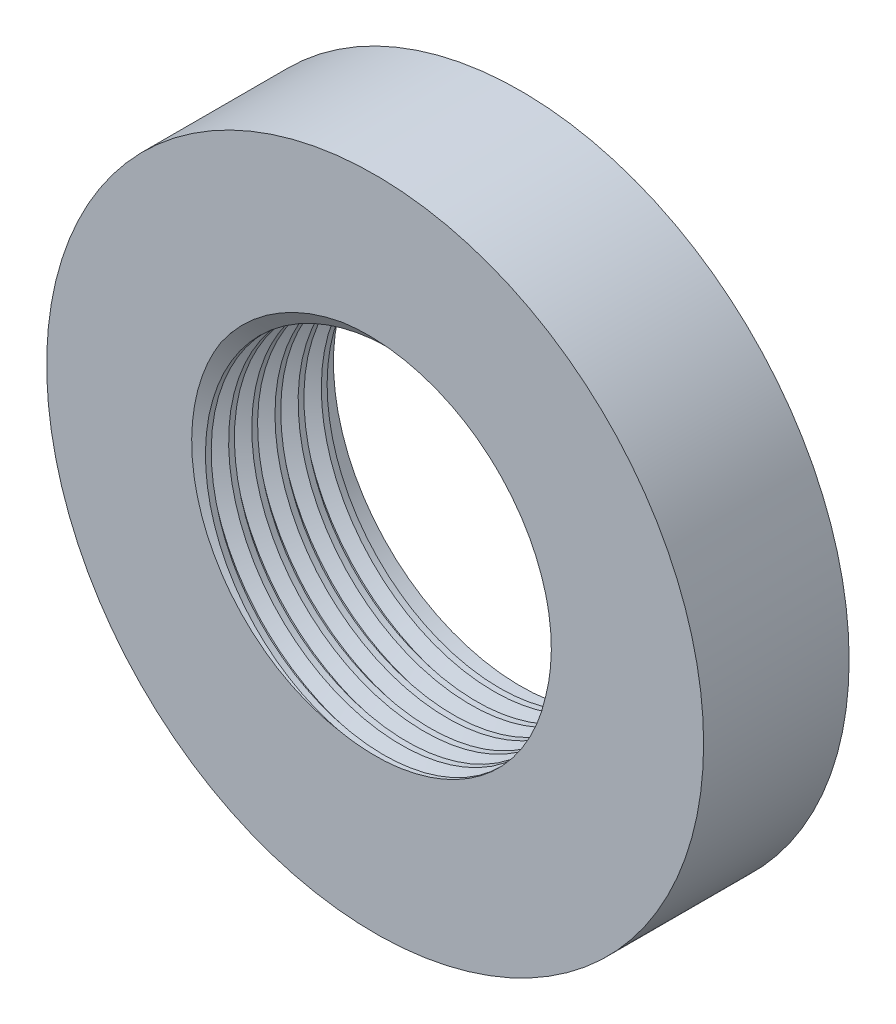
from build123d import *

# Parameters (mm, degrees)
SKETCH1_R           = 20
BOSS_EXTRUDE1_DEPTH = 8.86
SKETCH2_R           = 11.4
CUT_EXTRUDE1_DEPTH  = 27.86
THREAD1_PITCH       = 1.411111111
SKETCH8_R           = 17.165
CUT_EXTRUDE2_DEPTH  = 30.639545864


with BuildPart() as part:
    # Sketch1 → Boss-Extrude1 (new body)
    with BuildSketch(Plane.XY):
        Circle(SKETCH1_R)
    extrude(amount=BOSS_EXTRUDE1_DEPTH)

    # Sketch2 → Cut-Extrude1 (cut)
    with BuildSketch(Plane.XY):
        Circle(SKETCH2_R)
    extrude(amount=CUT_EXTRUDE1_DEPTH, mode=Mode.SUBTRACT)

    # Thread1: arcs per turn and ends read off the stored shape
    # Thread1: the profile of Thread Profile1 profile screwed along a right-hand helix through 6.27874 turns, 8 arcs to a turn; built about Z, then put on its axis
    thread1_z = Axis((0, 0, 0), (0, 0, 1))
    thread1_corners = [(11.4003, 0, -0.000173205), (11.4003, 0, 1.234895423), (10.63621371, 0, 0.793749998), (10.63621371, 0, 0.44097222)]
    with BuildLine(mode=Mode.PRIVATE) as thread1_profile:
        Line(thread1_corners[0], thread1_corners[1])
        Line(thread1_corners[1], thread1_corners[2])
        Line(thread1_corners[2], thread1_corners[3])
        Line(thread1_corners[3], thread1_corners[0])
    thread1_cap = Face(thread1_profile.wire())
    thread1_turn_angles = [0, 22.5, 45, 67.5, 90, 112.5, 135, 157.5, 180, 202.5, 225, 247.5, 270, 292.5, 315, 337.5, 360]
    thread1_turn_weights = [1, 0.9238795325112867, 1, 0.9238795325112867, 1, 0.9238795325112867, 1, 0.9238795325112867, 1, 0.9238795325112867, 1, 0.9238795325112867, 1, 0.9238795325112867, 1, 0.9238795325112867, 1]
    thread1_turn_rails = [Edge.make_bspline([Vector(p[0], p[1], 0).rotate(thread1_z, thread1_turn_angles[k]) / thread1_turn_weights[k] + Vector(0, 0, p[2] + THREAD1_PITCH * thread1_turn_angles[k] / 360) for k in range(17)], [0, 0, 0, 1, 1, 2, 2, 3, 3, 4, 4, 5, 5, 6, 6, 7, 7, 8, 8, 8], 2, thread1_turn_weights) for p in thread1_corners]
    thread1_turn_sides = [Face.make_surface_from_curves(thread1_turn_rails[p[0]], thread1_turn_rails[p[1]]) for p in [(0, 1), (1, 2), (2, 3), (3, 0)]]
    thread1_last_angles = [2160, 2182.5, 2205, 2227.5, 2250, 2255.173228346, 2260.346456693]
    thread1_last_weights = [1, 0.9238795325112867, 1, 0.9238795325112867, 1, 0.9959266382911455, 1]
    thread1_last_rails = [Edge.make_bspline([Vector(p[0], p[1], 0).rotate(thread1_z, thread1_last_angles[k]) / thread1_last_weights[k] + Vector(0, 0, p[2] + THREAD1_PITCH * thread1_last_angles[k] / 360) for k in range(7)], [0, 0, 0, 1, 1, 2, 2, 3, 3, 3], 2, thread1_last_weights) for p in thread1_corners]
    thread1_last_sides = [Face.make_surface_from_curves(thread1_last_rails[p[0]], thread1_last_rails[p[1]]) for p in [(0, 1), (1, 2), (2, 3), (3, 0)]]
    thread1 = Plane(origin=(0, 0, 0), x_dir=(1, 0, 0), z_dir=(0, 0, 1)) * Solid(Shell([*[p.moved(Location((0, 0, THREAD1_PITCH * i))) for i in range(6) for p in thread1_turn_sides], *thread1_last_sides, thread1_cap, thread1_cap.rotate(thread1_z, 2260.346456693).moved(Location((0, 0, THREAD1_PITCH * 2260.346456693 / 360)))]))
    add(thread1)

    # Sketch8 → Cut-Extrude2 (cut, through all)
    with BuildSketch(Plane.XY.offset(8.86)):
        Circle(SKETCH8_R)
    extrude(amount=CUT_EXTRUDE2_DEPTH, mode=Mode.SUBTRACT)


solid = part.part
